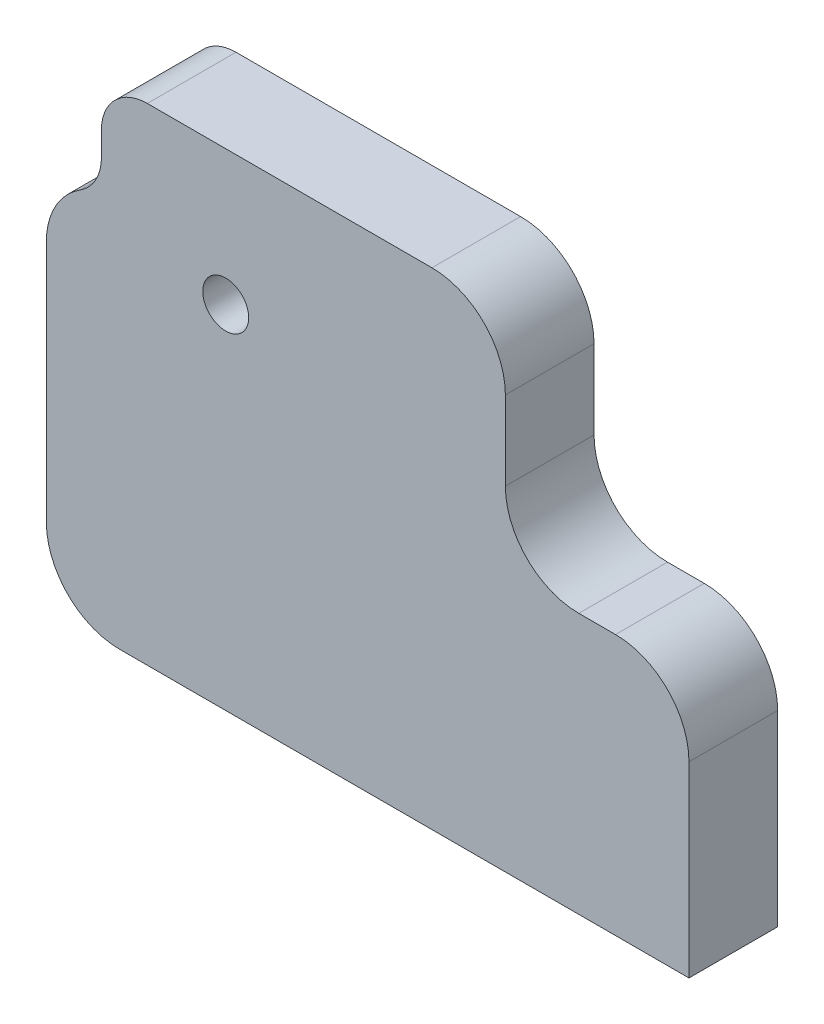
from build123d import *

# Parameters (mm, degrees)
BOSS_EXTRUDE1_DEPTH       = 4.83
M3X0_5_TAPPED_HOLE2_D     = 2.5
M3X0_5_TAPPED_HOLE3_D     = 2.5
M3X0_5_TAPPED_HOLE3_DEPTH = 5
M3X0_5_TAPPED_HOLE3_TIP   = 0.751075774
FILLET1_R                 = 2.5
FILLET2_R                 = 4
SKETCH20_W                = 35
SKETCH20_H                = 4.83
SKETCH20_R                = 1.25
BOSS_EXTRUDE2_DEPTH       = 4.5
FILLET4_R                 = 4


with BuildPart() as part:
    # Sketch1 → Boss-Extrude1 (new body)
    with BuildSketch(Plane.XY):
        Polygon((0, 15.7), (0, 0), (35, 0), (35, 9.7), (25, 9.7), (25, 22), (3, 22), (3, 15.7), align=None)
    extrude(amount=BOSS_EXTRUDE1_DEPTH)

    # M3x0.5 Tapped Hole2 (through all)
    with Locations(Plane.XY.offset(4.83)):
        with Locations((9.77, 14.65)):
            Hole(M3X0_5_TAPPED_HOLE2_D / 2)

    # M3x0.5 Tapped Hole3
    with Locations(Plane(origin=(0, 0, 0), x_dir=(-1, 0, 0), z_dir=(0, -1, 0))):
        with Locations((-19, -2.415), (-31, -2.415)):
            Hole(M3X0_5_TAPPED_HOLE3_D / 2, depth=M3X0_5_TAPPED_HOLE3_DEPTH)
            with Locations((0, 0, -(M3X0_5_TAPPED_HOLE3_DEPTH + M3X0_5_TAPPED_HOLE3_TIP / 2))):  # 118° drill point
                Cone(0, M3X0_5_TAPPED_HOLE3_D / 2, M3X0_5_TAPPED_HOLE3_TIP, mode=Mode.SUBTRACT)

    # Fillet1
    fillet1_edges = [part.edges().sort_by_distance(p)[0] for p in [
        (3, 15.7, 2.415),
        (3, 22, 2.415),
    ]]
    fillet(fillet1_edges, radius=FILLET1_R)

    # Fillet2
    fillet2_edges = [part.edges().sort_by_distance(p)[0] for p in [
        (35, 9.7, 2.415),
        (25, 9.7, 2.415),
        (25, 22, 2.415),
        (0, 15.7, 2.415),
    ]]
    fillet(fillet2_edges, radius=FILLET2_R)

    # Sketch20 → Boss-Extrude2 (add)
    with BuildSketch(Plane.XZ):
        with Locations((17.5, 2.415)):
            Rectangle(SKETCH20_W, SKETCH20_H)
        with Locations((31, 2.415)):
            Circle(SKETCH20_R, mode=Mode.SUBTRACT)
        with Locations((19, 2.415)):
            Circle(SKETCH20_R, mode=Mode.SUBTRACT)
    extrude(amount=BOSS_EXTRUDE2_DEPTH)

    # Fillet4
    fillet4_edges = [part.edges().sort_by_distance(p)[0] for p in [
        (0, -4.5, 2.415),
    ]]
    fillet(fillet4_edges, radius=FILLET4_R)


solid = part.part
